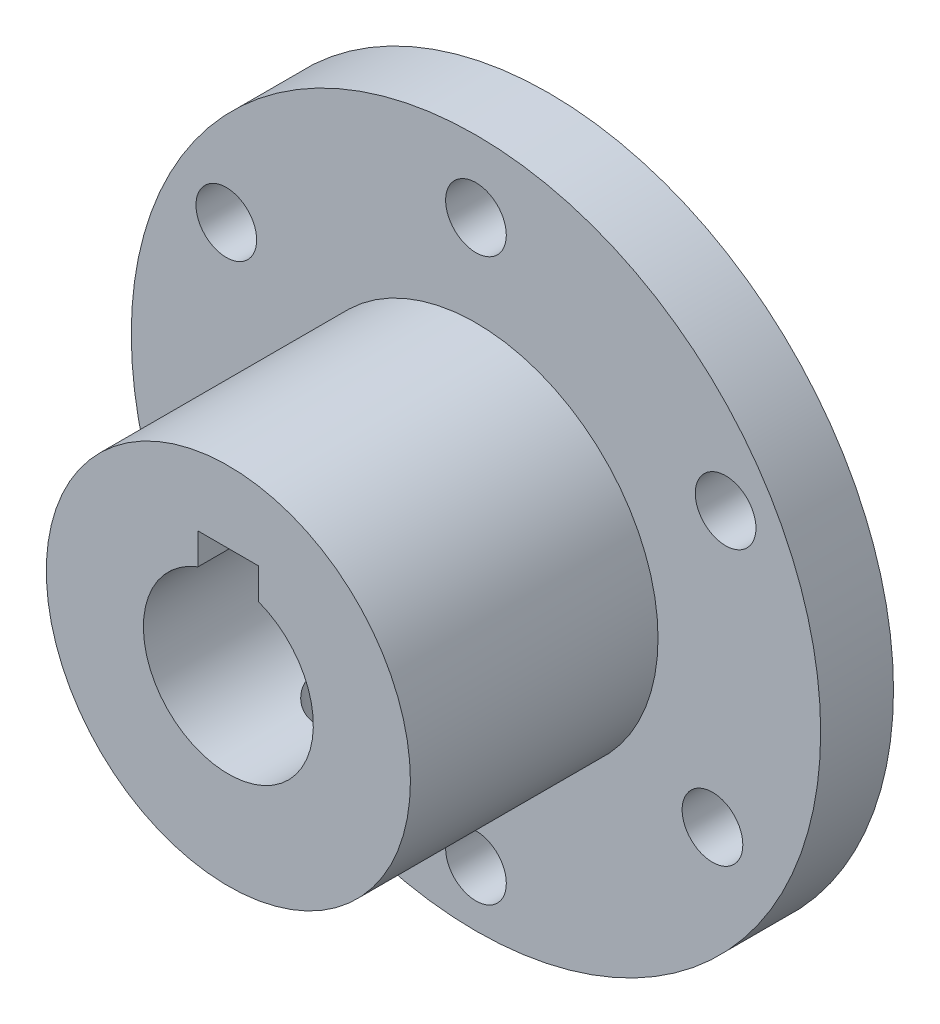
from build123d import *
from build123d.topology import SkipClean

# Parameters (mm, degrees)
SKETCH_1_R          = 15
SKETCH_1_R_2        = 7
EXTRUDE_1_DEPTH     = 20.4
EXTRUDE_START       = 6
SKETCH_2_R          = 28.4
SKETCH_2_R_2        = 7
EXTRUDE_2_DEPTH     = 6
SKETCH_3_R          = 2.5
CUT_EXTRUDE_1_DEPTH = 6
SKETCH_4_W          = 5
SKETCH_4_H          = 4.2
CUT_EXTRUDE_2_DEPTH = 50
SKETCH_5_R          = 3
CUT_EXTRUDE_3_DEPTH = 20.4


with BuildPart() as part:
    # 草图1 → 凸台-拉伸1 (new body)
    with BuildSketch(Plane.XY):
        Circle(SKETCH_1_R)
        Circle(SKETCH_1_R_2, mode=Mode.SUBTRACT)
    extrude(amount=EXTRUDE_1_DEPTH)

    # 草图2 → 凸台-拉伸2 (add)
    with SkipClean():  # the faces are left unmerged after this step: merging them gives an invalid solid
        with BuildSketch(Plane(origin=(0, 0, 0), x_dir=(-1, 0, 0), z_dir=(0, 0, -1)).offset(EXTRUDE_START)):
            Circle(SKETCH_2_R)
            Circle(SKETCH_2_R_2, mode=Mode.SUBTRACT)
        extrude(amount=-EXTRUDE_2_DEPTH)

    # 草图3 → 切除-拉伸1 (cut)
    with SkipClean():  # the faces are left unmerged after this step: merging them gives an invalid solid
        with BuildSketch(Plane.XY):
            with Locations((0, -23.75)):
                Circle(SKETCH_3_R)
            with Locations((-20.56810334, 11.875)):
                Circle(SKETCH_3_R)
            with Locations((20.56810334, 11.875)):
                Circle(SKETCH_3_R)
            with Locations((19.485571585, -11.25)):
                Circle(SKETCH_3_R)
            with Locations((-19.485571585, -11.25)):
                Circle(SKETCH_3_R)
            with Locations((0, 22.5)):
                Circle(SKETCH_3_R)
        extrude(amount=-CUT_EXTRUDE_1_DEPTH, mode=Mode.SUBTRACT)

    # 草图4 → 切除-拉伸2 (cut)
    with SkipClean():  # the faces are left unmerged after this step: merging them gives an invalid solid
        with BuildSketch(Plane.XY.offset(20.4)):
            with Locations((0, 7)):
                Rectangle(SKETCH_4_W, SKETCH_4_H)
        extrude(amount=-CUT_EXTRUDE_2_DEPTH, mode=Mode.SUBTRACT)
    add(part.part.scale(1), mode=Mode.REPLACE)  # the faces are merged on a copy

    # 草图5 → 切除-拉伸3 (cut)
    with BuildSketch(Plane(origin=(0, 0, 0), x_dir=(1, 0, 0), z_dir=(0, 1, 0))):
        with Locations((0, -10.2)):
            Circle(SKETCH_5_R)
    extrude(amount=-CUT_EXTRUDE_3_DEPTH, mode=Mode.SUBTRACT)


solid = part.part
